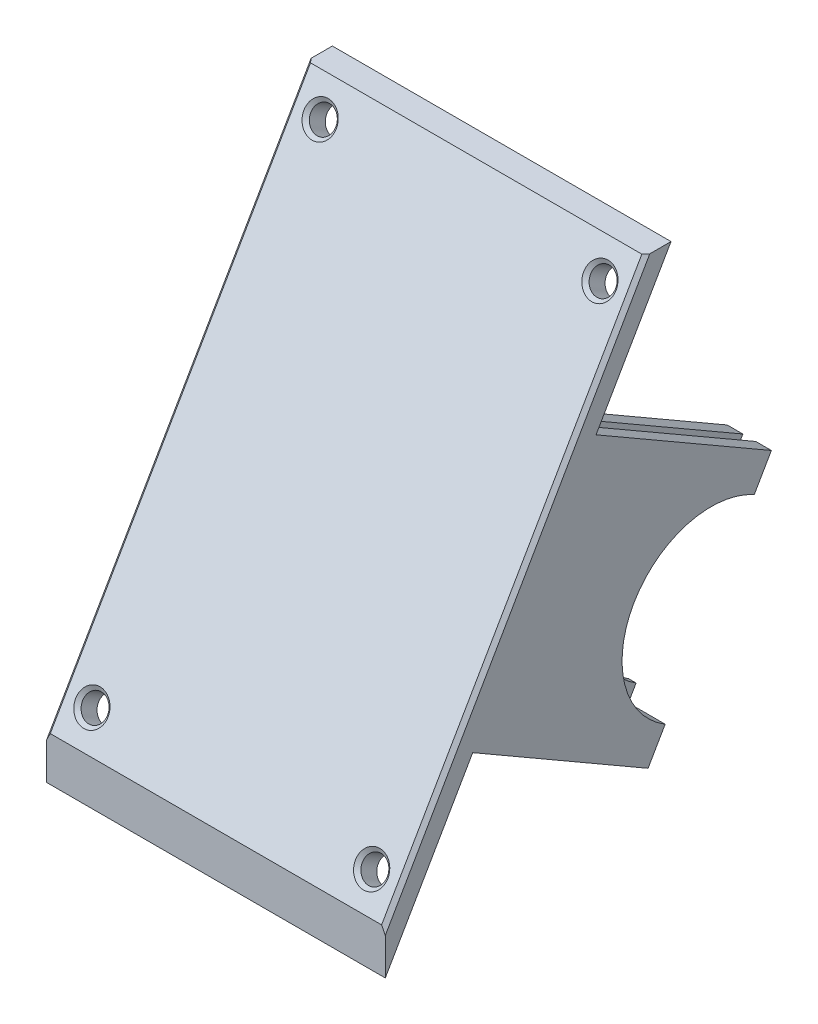
from build123d import *

# Parameters (mm, degrees)
BOSS_EXTRUDE1_DEPTH = 46
SKETCH2_R           = 1.7
CUT_EXTRUDE1_DEPTH  = 46
BOSS_EXTRUDE3_DEPTH = 27.5
SKETCH8_R           = 12.1
CUT_EXTRUDE2_DEPTH  = 63.75
BOSS_EXTRUDE4_START = -5
BOSS_EXTRUDE4_DEPTH = 1
BOSS_EXTRUDE5_START = -41
BOSS_EXTRUDE5_DEPTH = 1
CHAMFER1_SIZE       = 0.5


# Read off the part's stored shape, not the designer's step: Boss-Extrude5
with BuildPart() as part:
    # Sketch1 → Boss-Extrude1 (new body)
    with BuildSketch(Plane(origin=(0, 0, 0), x_dir=(0, 0, -1), z_dir=(1, 0, 0))):
        Polygon((0, 0), (0, 6), (35.345898385, 67.220891842), (38.81, 67.220891842), align=None)
    extrude(amount=BOSS_EXTRUDE1_DEPTH)

    # Sketch2 → Cut-Extrude1 (cut)
    with BuildSketch(Plane(origin=(0, 1.5, 2.598076211), x_dir=(1, 0, 0), z_dir=(0, 0.4999999999999947, 0.8660254037844417))):
        with Locations(Location((4, 9.5, 0), (0, 0, 270))):
            Circle(SKETCH2_R)
        with Locations(Location((42, 9.5, 0), (0, 0, 270))):
            Circle(SKETCH2_R)
        with Locations(Location((42, 71.5, 0), (0, 0, 270))):
            Circle(SKETCH2_R)
        with Locations(Location((4, 71.5, 0), (0, 0, 270))):
            Circle(SKETCH2_R)
    extrude(amount=-CUT_EXTRUDE1_DEPTH, mode=Mode.SUBTRACT)

    # Sketch7 → Boss-Extrude3 (add)
    with BuildSketch(Plane(origin=(0, 0, 0), x_dir=(-1, 0, 0), z_dir=(0, -0.49999999999999495, -0.8660254037844417))):
        Polygon((-42.125, 23.75), (-40, 23.75), (-40, 57.25), (-42.125, 57.25), (-42.125, 56), (-43.875, 56), (-43.875, 57.25), (-46, 57.25), (-46, 23.75), (-43.875, 23.75), (-43.875, 25), (-42.125, 25), align=None)
        Polygon((-6, 57.25), (-6, 23.75), (-3.875, 23.75), (-3.875, 25), (-2.125, 25), (-2.125, 23.75), (0, 23.75), (0, 57.25), (-2.125, 57.25), (-2.125, 56), (-3.875, 56), (-3.875, 57.25), align=None)
    extrude(amount=BOSS_EXTRUDE3_DEPTH)

    # Sketch8 → Cut-Extrude2 (cut)
    with BuildSketch(Plane(origin=(46, 0, 0), x_dir=(0, 0, -1), z_dir=(1, 0, 0))):
        with Locations((44.256224193, 21.214028853)):
            Circle(SKETCH8_R)
    extrude(amount=-CUT_EXTRUDE2_DEPTH, mode=Mode.SUBTRACT)

    # Sketch9 → Boss-Extrude4 (add)
    with BuildSketch(Plane(origin=(46, 0, 0), x_dir=(0, 0, -1), z_dir=(1, 0, 0)).offset(BOSS_EXTRUDE4_START)):
        with BuildLine():
            ThreePointArc((50.114698521, 31.801204045), (33.777316807, 27.264028853), (38.016698687, 10.846853661))
            Line((38.016698687, 10.846853661), (39.066908751, 12.665870851))
            ThreePointArc((39.066908751, 12.665870851), (35.595970155, 26.214028853), (49.064488458, 29.982186856))
            Line((49.064488458, 29.982186856), (50.114698521, 31.801204045))
        make_face()
    extrude(amount=-BOSS_EXTRUDE4_DEPTH)

    # Boss-Extrude5 outline → Boss-Extrude5 (add)
    with BuildSketch(Plane(origin=(46, 0, 0), x_dir=(0, 0, -1), z_dir=(1, 0, 0)).offset(BOSS_EXTRUDE5_START)):
        with BuildLine():
            ThreePointArc((39.066908751, 12.665870851), (35.595970155, 26.214028854), (49.064488458, 29.982186856))
            Line((49.064488458, 29.982186856), (50.114698521, 31.801204045))
            ThreePointArc((50.114698521, 31.801204045), (33.777316807, 27.264028853), (38.016698687, 10.846853661))
            Line((38.016698687, 10.846853661), (39.066908751, 12.665870851))
        make_face()
    extrude(amount=BOSS_EXTRUDE5_DEPTH)

    # Chamfer1
    chamfer1_edges = [part.edges().sort_by_distance(p)[0] for p in [
        (46, 36.610445921, -17.672949192),
        (4, 64.893059557, -34.001923789),
        (42, 64.893059557, -34.001923789),
        (42, 11.199484522, -3.001923789),
        (4, 11.199484522, -3.001923789),
        (0, 36.610445921, -17.672949192),
    ]]
    chamfer(chamfer1_edges, length=CHAMFER1_SIZE)


solid = part.part
